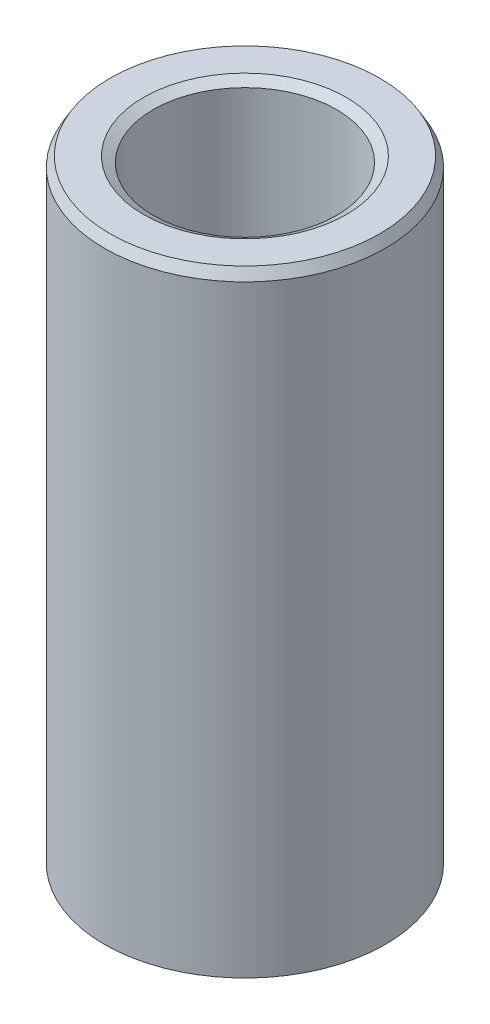
from build123d import *
from OCP.BRepFilletAPI import BRepFilletAPI_MakeChamfer

# Parameters (mm, degrees)
SKETCH1_R           = 27.5
BOSS_EXTRUDE1_DEPTH = 121.049952871
SKETCH2_R           = 17.950576371
CUT_EXTRUDE1_DEPTH  = 128.143977798
CHAMFER1_SIZE       = 1.914556159
CHAMFER1_SIZE2      = 1.105369514


with BuildPart() as part:
    # Sketch1 → Boss-Extrude1 (new body)
    with BuildSketch(Plane(origin=(0, 0, 0), x_dir=(1, 0, 0), z_dir=(0, 1, 0))):
        Circle(SKETCH1_R)
    extrude(amount=BOSS_EXTRUDE1_DEPTH)

    # Sketch2 → Cut-Extrude1 (cut, through all)
    with BuildSketch(Plane(origin=(0, 0, 0), x_dir=(1, 0, 0), z_dir=(0, 1, 0))):
        Circle(SKETCH2_R)
    extrude(amount=CUT_EXTRUDE1_DEPTH, mode=Mode.SUBTRACT)

    # Chamfer1: one chamfer whose edges measure the first distance from different faces: ONE call of the kernel's chamfer builder (chamfer() names one face for all edges)
    chamfer1_edges_1 = [part.edges().sort_by_distance(p)[0] for p in [
        (-17.950576371, 121.049952871, 0),
    ]]
    chamfer1_side_1 = [part.faces().sort_by_distance(p)[0] for p in [
        (-26.722182541, 121.049952871, 0),
    ]]
    chamfer1_edges_2 = [part.edges().sort_by_distance(p)[0] for p in [
        (-17.950576371, 0, 0),
    ]]
    chamfer1_side_2 = [part.faces().sort_by_distance(p)[0] for p in [
        (-17.950576371, 60.524976436, 0),
    ]]
    chamfer1_edges_3 = [part.edges().sort_by_distance(p)[0] for p in [
        (-27.5, 0, 0),
    ]]
    chamfer1_side_3 = [part.faces().sort_by_distance(p)[0] for p in [
        (-26.722182541, 0, 0),
    ]]
    chamfer1_edges_4 = [part.edges().sort_by_distance(p)[0] for p in [
        (-27.5, 121.049952871, 0),
    ]]
    chamfer1_side_4 = [part.faces().sort_by_distance(p)[0] for p in [
        (-27.5, 60.524976436, 0),
    ]]
    chamfer1 = BRepFilletAPI_MakeChamfer(part.part.solid().wrapped)
    for e in chamfer1_edges_1:
        chamfer1.Add(CHAMFER1_SIZE, CHAMFER1_SIZE2, e.wrapped, chamfer1_side_1[0].wrapped)  # the first distance lies on this face
    for e in chamfer1_edges_2:
        chamfer1.Add(CHAMFER1_SIZE, CHAMFER1_SIZE2, e.wrapped, chamfer1_side_2[0].wrapped)  # the first distance lies on this face
    for e in chamfer1_edges_3:
        chamfer1.Add(CHAMFER1_SIZE, CHAMFER1_SIZE2, e.wrapped, chamfer1_side_3[0].wrapped)  # the first distance lies on this face
    for e in chamfer1_edges_4:
        chamfer1.Add(CHAMFER1_SIZE, CHAMFER1_SIZE2, e.wrapped, chamfer1_side_4[0].wrapped)  # the first distance lies on this face
    add(Compound.cast(chamfer1.Shape()), mode=Mode.REPLACE)


solid = part.part
